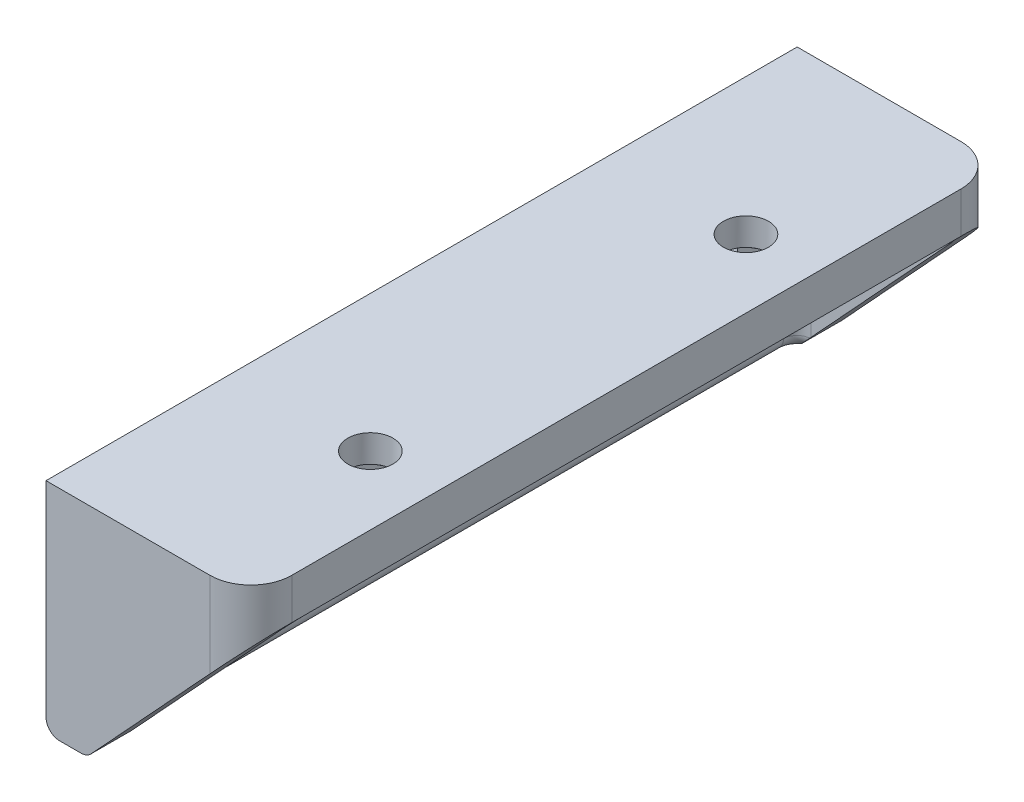
from build123d import *

# Parameters (mm, degrees)
ESQUISSE2_W             = 15
ESQUISSE2_H             = 3
BOSS_EXTRU_1_DEPTH      = 55
BOSS_EXTRU_2_DEPTH      = 3
BOSS_EXTRU_3_DEPTH      = 3
CONG_1_R                = 3
CONG_2_R                = 1
CONG_3_START            = 4
CONG_3_3_DEPTH          = 47
CONG_3_START_2          = -1
CONG_3_4_DEPTH          = 57
ENL_V_MAT_EXTRU_1_REACH = 61.211
ESQUISSE5_R             = 1.65
ENL_V_MAT_EXTRU_2_DEPTH = 1
ESQUISSE8_R             = 1.65
ENL_V_MAT_EXTRU_3_DEPTH = 59.472215766


with BuildPart() as part:
    # Esquisse2 → Boss.-Extru.1 (new body)
    with BuildSketch(Plane.XY):
        with BuildLine():
            Line((3, 0), (0, 0))
            Line((0, 0), (0, -12))
            ThreePointArc((0, -12), (0.292893219, -12.707106781), (1, -13))
            Line((1, -13), (3, -13))
            Line((3, -13), (3, 0))
        make_face()
        with Locations((7.5, 1.5)):
            Rectangle(ESQUISSE2_W, ESQUISSE2_H)
    extrude(amount=BOSS_EXTRU_1_DEPTH)

    # Esquisse3 → Boss.-Extru.2 (add)
    with BuildSketch(Plane(origin=(3, 0, 55), x_dir=(-1, 0, 0), z_dir=(0, 0, -1))):
        Polygon((-12, 0), (0, -13), (0, 0), align=None)
    extrude(amount=BOSS_EXTRU_2_DEPTH)

    # Esquisse4 → Boss.-Extru.3 (add)
    with BuildSketch(Plane(origin=(3, 0, 0), x_dir=(-1, 0, 0), z_dir=(0, 0, -1))):
        Polygon((0, 0), (-12, 0), (0, -13), align=None)
    extrude(amount=-BOSS_EXTRU_3_DEPTH)

    # Congé1
    cong_1_edges = [part.edges().sort_by_distance(p)[0] for p in [
        (15, 1.5, 0),
        (15, 1.5, 55),
    ]]
    fillet(cong_1_edges, radius=CONG_1_R)

    # Congé2
    # the kernel refuses this fillet: 1 mm, written as the material it adds along each edge
    with BuildSketch(Plane(origin=(4, -1, 4), x_dir=(0, 1, 0), z_dir=(-1, 0, 0))) as cong_2_piece_1_section:
        Polygon((0, 0), (CONG_2_R, 0), (CONG_2_R, CONG_2_R), (0, CONG_2_R), align=None)
    cong_2_piece_1 = extrude(amount=CONG_2_R, mode=Mode.PRIVATE)
    cong_2_piece_1 = cong_2_piece_1 - Plane(origin=(4, -1, 4), x_dir=(0, -0.7071067811865475, 0.7071067811865475), z_dir=(-1, 0, 0)) * Sphere(CONG_2_R, mode=Mode.PRIVATE)
    add(cong_2_piece_1)
    with BuildSketch(Plane(origin=(4, -1, 51), x_dir=(0, 1, 0), z_dir=(-1, 0, 0))) as cong_2_piece_2_section:
        Polygon((0, 0), (CONG_2_R, 0), (CONG_2_R, -CONG_2_R), (0, -CONG_2_R), align=None)
    cong_2_piece_2 = extrude(amount=CONG_2_R, mode=Mode.PRIVATE)
    cong_2_piece_2 = cong_2_piece_2 - Plane(origin=(4, -1, 51), x_dir=(0, -0.7071067811865475, -0.7071067811865475), z_dir=(-1, 0, 0)) * Sphere(CONG_2_R, mode=Mode.PRIVATE)
    add(cong_2_piece_2)
    with BuildSketch(Plane(origin=(3, 0, 4), x_dir=(0, -1, 0), z_dir=(0, 0, 1))) as cong_2_piece_3:
        with BuildLine():
            CenterArc((CONG_2_R, CONG_2_R), CONG_2_R, 180, 90)
            Line((0, CONG_2_R), (0, 0))
            Line((0, 0), (CONG_2_R, 0))
        make_face()
    extrude(amount=47)
    with BuildSketch(Plane(origin=(4, 0, 52), x_dir=(0, 0, -1), z_dir=(1, 0, 0))) as cong_2_piece_4_section:
        with BuildLine():
            CenterArc((CONG_2_R, -CONG_2_R), CONG_2_R, 90, 90)
            Line((0, -CONG_2_R), (0, 0))
            Line((0, 0), (CONG_2_R, 0))
        make_face()
    cong_2_piece_4 = extrude(amount=11, mode=Mode.PRIVATE)
    cong_2_piece_4 = split(cong_2_piece_4, bisect_by=Plane(origin=(9.939297125, -5.482428115, 52), z_dir=(-0.7348034446274879, 0.6782801027330657, 0)), keep=Keep.TOP, mode=Mode.PRIVATE)
    add(cong_2_piece_4)
    with BuildSketch(Plane(origin=(3, -13, 52), x_dir=(0, 0, -1), z_dir=(0, 1, 0))) as cong_2_piece_5_section:
        with BuildLine():
            CenterArc((CONG_2_R, -CONG_2_R), CONG_2_R, 90, 90)
            Line((0, -CONG_2_R), (0, 0))
            Line((0, 0), (CONG_2_R, 0))
        make_face()
    cong_2_piece_5 = extrude(amount=12, mode=Mode.PRIVATE)
    cong_2_piece_5 = split(cong_2_piece_5, bisect_by=Plane(origin=(3, -13, 52), z_dir=(-0.7348034446274879, 0.6782801027330657, 0)), keep=Keep.TOP, mode=Mode.PRIVATE)
    add(cong_2_piece_5)
    with BuildSketch(Plane(origin=(3, -13, 3), x_dir=(1, 0, 0), z_dir=(0, 1, 0))) as cong_2_piece_6_section:
        with BuildLine():
            CenterArc((CONG_2_R, -CONG_2_R), CONG_2_R, 90, 90)
            Line((0, -CONG_2_R), (0, 0))
            Line((0, 0), (CONG_2_R, 0))
        make_face()
    cong_2_piece_6 = extrude(amount=12, mode=Mode.PRIVATE)
    cong_2_piece_6 = split(cong_2_piece_6, bisect_by=Plane(origin=(3, -13, 3), z_dir=(-0.7348034446274879, 0.6782801027330657, 0)), keep=Keep.TOP, mode=Mode.PRIVATE)
    add(cong_2_piece_6)
    with BuildSketch(Plane(origin=(4, 0, 3), x_dir=(0, -1, 0), z_dir=(1, 0, 0))) as cong_2_piece_7_section:
        with BuildLine():
            CenterArc((CONG_2_R, -CONG_2_R), CONG_2_R, 90, 90)
            Line((0, -CONG_2_R), (0, 0))
            Line((0, 0), (CONG_2_R, 0))
        make_face()
    cong_2_piece_7 = extrude(amount=11, mode=Mode.PRIVATE)
    cong_2_piece_7 = split(cong_2_piece_7, bisect_by=Plane(origin=(9.939297125, -5.482428115, 3), z_dir=(-0.7348034446274879, 0.6782801027330657, 0)), keep=Keep.TOP, mode=Mode.PRIVATE)
    add(cong_2_piece_7)

    # Congé3: read off the stored shape, not the designer's step
    # Congé3 outline → Congé3 (revolve, cut)
    with BuildSketch(Plane(origin=(4, 0, 51), x_dir=(1, 0, 0), z_dir=(0, 0, 1))):
        with BuildLine():
            ThreePointArc((2, -13), (1.292893219, -12.707106781), (1, -12))
            Line((1, -12), (1, -13))
            Line((1, -13), (2, -13))
        make_face()
    revolve(axis=Axis((4, 0, 51), (0, 1, 0)), mode=Mode.SUBTRACT)

    # Cong_3 2 outline → Cong_3 2 (revolve, cut)
    with BuildSketch(Plane(origin=(4, 0, 4), x_dir=(1, 0, 0), z_dir=(0, 0, 1))):
        with BuildLine():
            ThreePointArc((2, -13), (1.292893219, -12.707106781), (1, -12))
            Line((1, -12), (1, -13))
            Line((1, -13), (2, -13))
        make_face()
    revolve(axis=Axis((4, 0, 4), (0, 1, 0)), mode=Mode.SUBTRACT)

    # Cong_3 3 outline → Cong_3 3 (cut)
    with BuildSketch(Plane.XY.offset(CONG_3_START)):
        with BuildLine():
            Line((2, -13), (3, -13))
            Line((3, -13), (3, -12))
            ThreePointArc((3, -12), (2.707106781, -12.707106781), (2, -13))
        make_face()
    extrude(amount=CONG_3_3_DEPTH, mode=Mode.SUBTRACT)

    # Cong_3 4 outline → Cong_3 4 (cut)
    with BuildSketch(Plane.XY.offset(CONG_3_START_2)):
        with BuildLine():
            Line((2.562168768, -13), (3, -13))
            Line((3, -13), (3.296972213, -12.678280103))
            ThreePointArc((3.296972213, -12.678280103), (2.963242263, -12.916045878), (2.562168768, -13))
        make_face()
    extrude(amount=CONG_3_4_DEPTH, mode=Mode.SUBTRACT)

    # Esquisse5 → Enlèv. mat.-Extru.1 (cut, up to next)
    with BuildSketch(Plane(origin=(0, 3, 0), x_dir=(1, 0, 0), z_dir=(0, 1, 0)), mode=Mode.PRIVATE) as enl_v_mat_extru_1_sk1:
        with Locations(Location((10, -41.25, 0), (0, 0, 270))):
            Circle(ESQUISSE5_R)
    enl_v_mat_extru_1_tool1 = extrude(enl_v_mat_extru_1_sk1.sketch, amount=-ENL_V_MAT_EXTRU_1_REACH, mode=Mode.PRIVATE) & part.part
    # Esquisse5 → Enlèv. mat.-Extru.1 (cut, up to next)
    with BuildSketch(Plane(origin=(0, 3, 0), x_dir=(1, 0, 0), z_dir=(0, 1, 0)), mode=Mode.PRIVATE) as enl_v_mat_extru_1_sk2:
        with Locations(Location((10, -13.75, 0), (0, 0, 270))):
            Circle(ESQUISSE5_R)
    enl_v_mat_extru_1_tool2 = extrude(enl_v_mat_extru_1_sk2.sketch, amount=-ENL_V_MAT_EXTRU_1_REACH, mode=Mode.PRIVATE) & part.part
    add(enl_v_mat_extru_1_tool1.solids().sort_by_distance((10, 3, 41.25))[0], mode=Mode.SUBTRACT)
    add(enl_v_mat_extru_1_tool2.solids().sort_by_distance((10, 3, 13.75))[0], mode=Mode.SUBTRACT)

    # Esquisse7 → Enlèv. mat.-Extru.2 (cut)
    with BuildSketch(Plane(origin=(0, 0, 0), x_dir=(-1, 0, 0), z_dir=(0, -1, 0))):
        Polygon((-10, -37.785898385), (-13, -39.517949192), (-13, -42.982050808), (-10, -44.714101615), (-7, -42.982050808), (-7, -39.517949192), align=None)
        Polygon((-10, -10.285898385), (-13, -12.017949192), (-13, -15.482050808), (-10, -17.214101615), (-7, -15.482050808), (-7, -12.017949192), align=None)
    extrude(amount=-ENL_V_MAT_EXTRU_2_DEPTH, mode=Mode.SUBTRACT)

    # Esquisse8 → Enlèv. mat.-Extru.3 (cut, through all)
    with BuildSketch(Plane.ZY):
        with Locations(Location((46, -4.5, 0), (0, 0, 270))):
            Circle(ESQUISSE8_R)
        with Locations(Location((9, -4.5, 0), (0, 0, 270))):
            Circle(ESQUISSE8_R)
    extrude(amount=-ENL_V_MAT_EXTRU_3_DEPTH, mode=Mode.SUBTRACT)


solid = part.part
